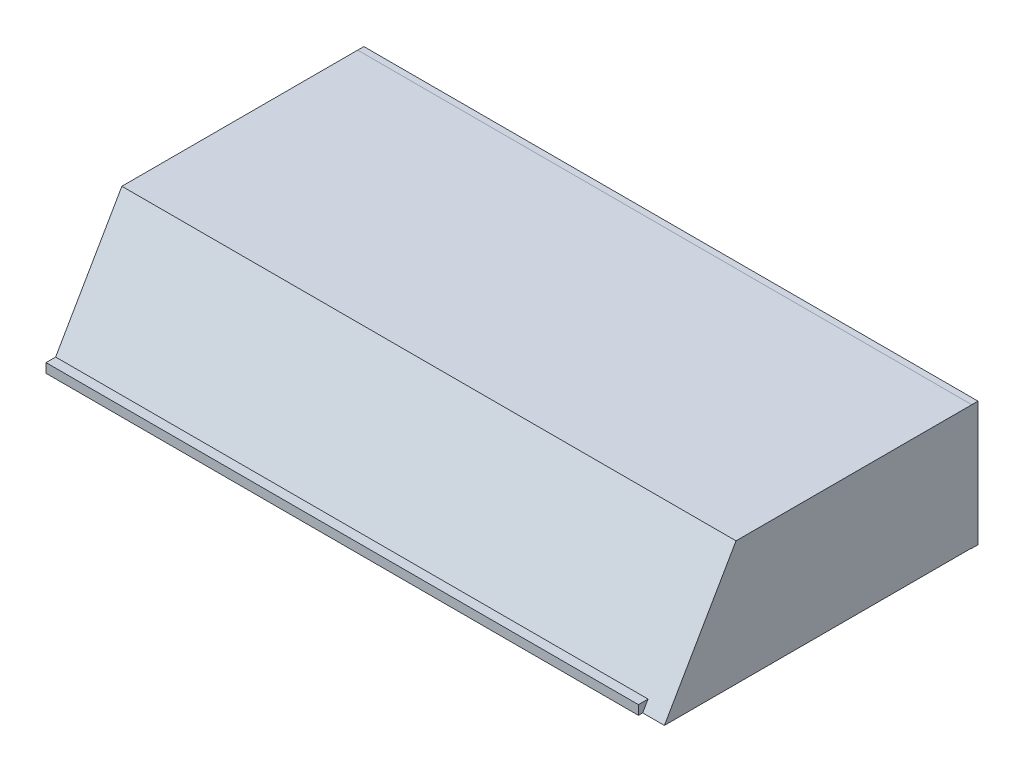
from build123d import *

# Parameters (mm, degrees)
BOSS_EXTRUDE1_DEPTH = 198
SHELL1_T            = -7
BOSS_EXTRUDE2_DEPTH = 191
BOSS_EXTRUDE3_DEPTH = 191
SKETCH4_R           = 1.585
CUT_EXTRUDE1_DEPTH  = 5
SKETCH6_W           = 198
SKETCH6_H           = 40.103607498
BOSS_EXTRUDE4_DEPTH = 2


with BuildPart() as part:
    # Sketch1 → Boss-Extrude1 (new body)
    with BuildSketch(Plane(origin=(0, 0, 0), x_dir=(0, 0, -1), z_dir=(1, 0, 0))):
        Polygon((22.10846405, 0), (32.441807929, 17.899216821), (45.200737204, 39.99998538), (121.214199537, 39.99998538), (121.18, 0), align=None)
    extrude(amount=BOSS_EXTRUDE1_DEPTH)

    # Shell1
    shell1_openings = [part.faces().sort_by_distance(p)[0] for p in [
        (99, 0, -71.644232025),
    ]]
    offset(amount=SHELL1_T, openings=shell1_openings, kind=Kind.INTERSECTION)

    # Sketch2 → Boss-Extrude2 (add)
    with BuildSketch(Plane.ZY):
        Polygon((-30.191216521, 0), (-32.974854852, 0), (-52.025978727, 32.99998538), (-49.242340395, 32.99998538), align=None)
    extrude(amount=-BOSS_EXTRUDE2_DEPTH)

    # Sketch3 → Boss-Extrude3 (add)
    with BuildSketch(Plane.ZY):
        Polygon((-121.18, 0), (-20.738207744, 0), (-20.738207744, 3), (-115.983847577, 3), align=None)
    extrude(amount=-BOSS_EXTRUDE3_DEPTH)

    # Sketch4 → Cut-Extrude1 (cut)
    with BuildSketch(Plane(origin=(0, 3, 0), x_dir=(1, 0, 0), z_dir=(0, 1, 0))):
        with Locations((11, 109.182562408)):
            Circle(SKETCH4_R)
        with Locations((12.010293652, 44.069600053)):
            Circle(SKETCH4_R)
    cut_extrude1 = extrude(amount=-CUT_EXTRUDE1_DEPTH, mode=Mode.SUBTRACT)

    # Mirror1: Cut-Extrude1 across plane
    add(cut_extrude1.mirror(Plane(origin=(99, 0, 0), x_dir=(0, 0, 1), z_dir=(1, 0, 0))), mode=Mode.SUBTRACT)

    # Sketch6 → Boss-Extrude4 (add)
    with BuildSketch(Plane(origin=(0, -0.10360746, -121.179911417), x_dir=(-1, 0, 0), z_dir=(0, -0.0008549884286730706, -0.9999996344973268))):
        with Locations((-99, 20.051803749)):
            Rectangle(SKETCH6_W, SKETCH6_H)
    extrude(amount=BOSS_EXTRUDE4_DEPTH)


solid = part.part
